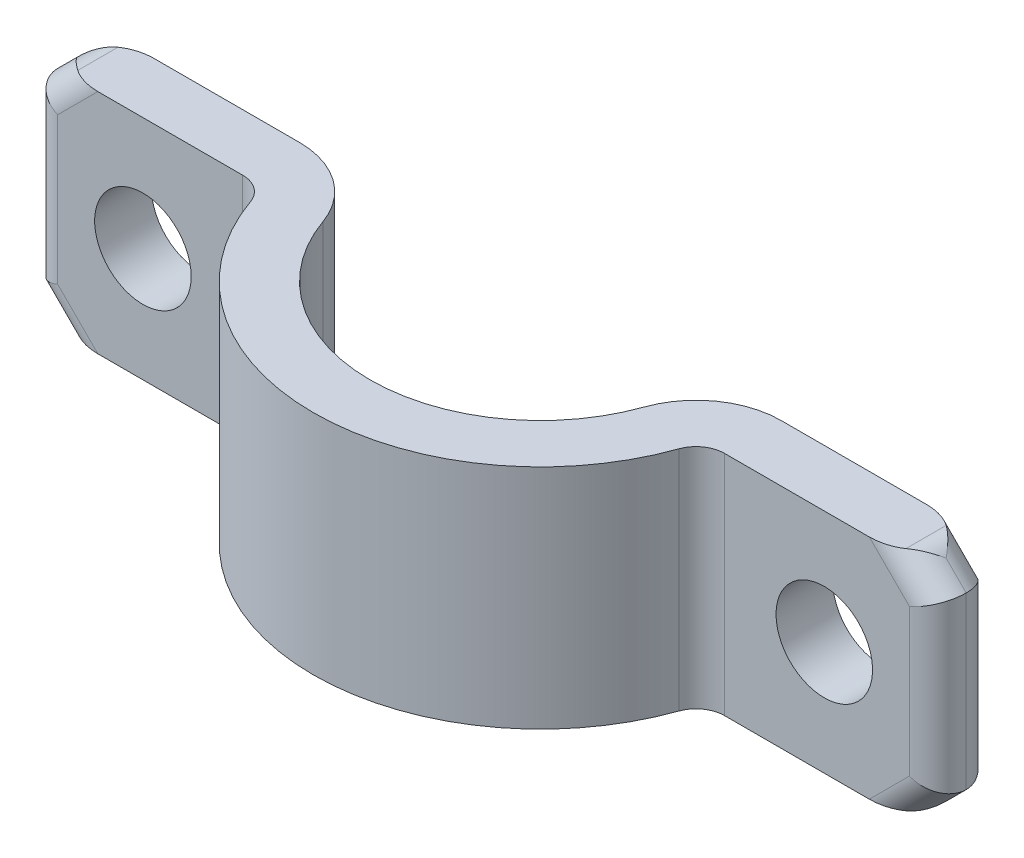
from build123d import *

# Parameters (mm, degrees)
BOSS_EXTRUDE1_DEPTH = 8
SKETCH2_R           = 1.7
CUT_EXTRUDE1_DEPTH  = 19.867962264
CHAMFER1_SIZE       = 1
FILLET1_R           = 1


with BuildPart() as part:
    # Sketch1 → Boss-Extrude1 (new body)
    with BuildSketch(Plane(origin=(0, 0, 0), x_dir=(1, 0, 0), z_dir=(0, 1, 0))):
        with BuildLine():
            Line((-16, 0), (-8.485281374, 0))
            ThreePointArc((-8.485281374, 0), (-6.753230567, -0.550510257), (-5.656854249, -2))
            ThreePointArc((-5.656854249, -2), (-3.464101615, -4.898979486), (0, -6))
            Line((0, -6), (0, -8))
            ThreePointArc((0, -8), (-4.618802154, -6.531972647), (-7.542472333, -2.666666667))
            ThreePointArc((-7.542472333, -2.666666667), (-7.907931105, -2.183503419), (-8.485281374, -2))
            Line((-8.485281374, -2), (-16, -2))
            Line((-16, -2), (-16, 0))
        make_face()
    extrude(amount=BOSS_EXTRUDE1_DEPTH)

    # Sketch2 → Cut-Extrude1 (cut, through all)
    with BuildSketch(Plane.XY.offset(2)):
        with Locations((-12, 4)):
            Circle(SKETCH2_R)
    extrude(amount=-CUT_EXTRUDE1_DEPTH, mode=Mode.SUBTRACT)

    # Chamfer1
    chamfer1_edges = [part.edges().sort_by_distance(p)[0] for p in [
        (-16, 0, 1),
        (-16, 8, 1),
    ]]
    chamfer(chamfer1_edges, length=CHAMFER1_SIZE)

    # Fillet1
    fillet1_edges = [part.edges().sort_by_distance(p)[0] for p in [
        (-16, 4, 0),
        (-16, 4, 2),
        (-15.5, 0.5, 0),
        (-15.5, 0.5, 2),
        (-15.5, 7.5, 0),
        (-15.5, 7.5, 2),
        (-15, 8, 1),
        (-15, 0, 1),
    ]]
    fillet(fillet1_edges, radius=FILLET1_R - 0.0001)  # a hair under: the kernel refuses the full size

    # Mirror1: part across plane


with BuildPart() as part_1:
    add(part.part)
    add(part.part.mirror(Plane(origin=(0, 8, 6), x_dir=(0, 0, 1), z_dir=(-1, 0, 0))))


solid = part_1.part
